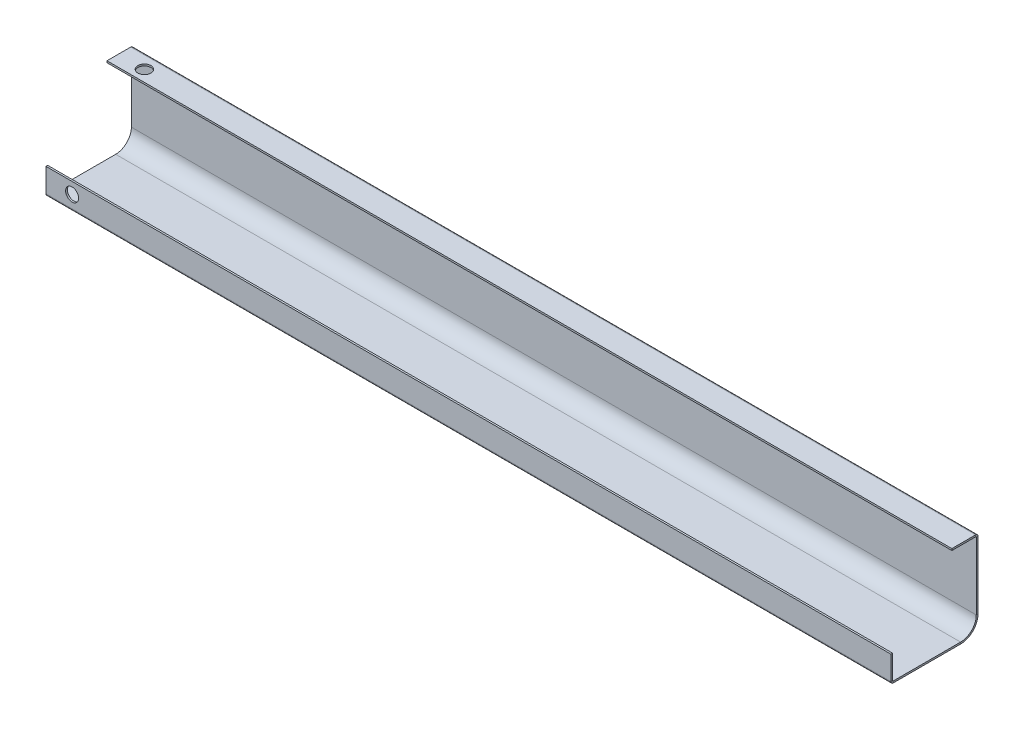
from build123d import *

# Parameters (mm, degrees)
SKETCH_2_W                       = 970
SKETCH_2_H                       = 100
SM_BASE_FLANGE_1_DEPTH           = 2
SM_EDGE_FLANGE_1_STRIP_W         = 44
SM_EDGE_FLANGE_1_STRIP_H         = 2
SM_EDGE_FLANGE_1_STRIP_CUT_DEPTH = 970
SM_EDGE_FLANGE_1_DEPTH           = 970
SM_EDGE_FLANGE_2_STRIP_W         = 9.4732
SM_EDGE_FLANGE_2_STRIP_H         = 2
SM_EDGE_FLANGE_2_STRIP_CUT_DEPTH = 970
SM_EDGE_FLANGE_2_DEPTH           = 970
SM_EDGE_FLANGE_3_STRIP_W         = 9.4732
SM_EDGE_FLANGE_3_STRIP_H         = 2
SM_EDGE_FLANGE_3_STRIP_CUT_DEPTH = 970
SM_EDGE_FLANGE_3_DEPTH           = 970
SKETCH_16_R                      = 7.5
CUT_EXTRUDE_1_DEPTH              = 10
SKETCH_17_R                      = 7.5
CUT_EXTRUDE_2_DEPTH              = 10


# Sheet-metal steps are written as plain solids
with BuildPart() as part:
    # Sketch 2 → 基体-法兰1 (new body)
    with BuildSketch(Plane.XY):
        Rectangle(SKETCH_2_W, SKETCH_2_H)
    extrude(amount=-SM_BASE_FLANGE_1_DEPTH)

    # 边线-法兰1 strip (across the edge) → 边线-法兰1 strip cut (cut)
    with BuildSketch(Plane(origin=(-485, -50, 0), x_dir=(0, 1, 0), z_dir=(1, 0, 0))):
        with Locations((-2, -1)):
            Rectangle(SM_EDGE_FLANGE_1_STRIP_W, SM_EDGE_FLANGE_1_STRIP_H)
    extrude(amount=SM_EDGE_FLANGE_1_STRIP_CUT_DEPTH, mode=Mode.SUBTRACT)

    # 边线-法兰1 section (across the edge) → 边线-法兰1 (add)
    with BuildSketch(Plane(origin=(-485, -50, 0), x_dir=(0, 1, 0), z_dir=(1, 0, 0))):
        with BuildLine():
            Line((0, 18), (0, 98))
            Line((0, 98), (2, 98))
            Line((2, 98), (2, 18))
            ThreePointArc((2, 18), (7.272077939, 5.272077939), (20, 0))
            Line((20, 0), (20, -2))
            ThreePointArc((20, -2), (5.857864376, 3.857864376), (0, 18))
        make_face()
    extrude(amount=SM_EDGE_FLANGE_1_DEPTH)

    # 边线-法兰2 strip (across the edge) → 边线-法兰2 strip cut (cut)
    with BuildSketch(Plane(origin=(485, 50, 0), x_dir=(0, -1, 0), z_dir=(-1, 0, 0))):
        with Locations((-2, -1)):
            Rectangle(SM_EDGE_FLANGE_2_STRIP_W, SM_EDGE_FLANGE_2_STRIP_H)
    extrude(amount=SM_EDGE_FLANGE_2_STRIP_CUT_DEPTH, mode=Mode.SUBTRACT)

    # 边线-法兰2 section (across the edge) → 边线-法兰2 (add)
    with BuildSketch(Plane(origin=(485, 50, 0), x_dir=(0, -1, 0), z_dir=(-1, 0, 0))):
        with BuildLine():
            Line((0, 0.7366), (0, 28))
            Line((0, 28), (2, 28))
            Line((2, 28), (2, 0.7366))
            ThreePointArc((2, 0.7366), (2.215745145, 0.215745145), (2.7366, 0))
            Line((2.7366, 0), (2.7366, -2))
            ThreePointArc((2.7366, -2), (0.801531583, -1.198468417), (0, 0.7366))
        make_face()
    extrude(amount=SM_EDGE_FLANGE_2_DEPTH)

    # 边线-法兰3 strip (across the edge) → 边线-法兰3 strip cut (cut)
    with BuildSketch(Plane(origin=(-485, -48, 98), x_dir=(0, 0, -1), z_dir=(1, 0, 0))):
        with Locations((-2, -1)):
            Rectangle(SM_EDGE_FLANGE_3_STRIP_W, SM_EDGE_FLANGE_3_STRIP_H)
    extrude(amount=SM_EDGE_FLANGE_3_STRIP_CUT_DEPTH, mode=Mode.SUBTRACT)

    # 边线-法兰3 section (across the edge) → 边线-法兰3 (add)
    with BuildSketch(Plane(origin=(-485, -48, 98), x_dir=(0, 0, -1), z_dir=(1, 0, 0))):
        with BuildLine():
            Line((0, 0.7366), (0, 28))
            Line((0, 28), (2, 28))
            Line((2, 28), (2, 0.7366))
            ThreePointArc((2, 0.7366), (2.215745145, 0.215745145), (2.7366, 0))
            Line((2.7366, 0), (2.7366, -2))
            ThreePointArc((2.7366, -2), (0.801531583, -1.198468417), (0, 0.7366))
        make_face()
    extrude(amount=SM_EDGE_FLANGE_3_DEPTH)

    # 草图16 → 切除-拉伸1 (cut)
    with BuildSketch(Plane(origin=(0, 50, 0), x_dir=(1, 0, 0), z_dir=(0, 1, 0))):
        with Locations(Location((-455, -15, 0), (0, 0, 270))):
            Circle(SKETCH_16_R)
    extrude(amount=-CUT_EXTRUDE_1_DEPTH, mode=Mode.SUBTRACT)

    # 草图17 → 切除-拉伸2 (cut)
    with BuildSketch(Plane.XY.offset(98)):
        with Locations((-455, -33)):
            Circle(SKETCH_17_R)
    extrude(amount=-CUT_EXTRUDE_2_DEPTH, mode=Mode.SUBTRACT)


solid = part.part
